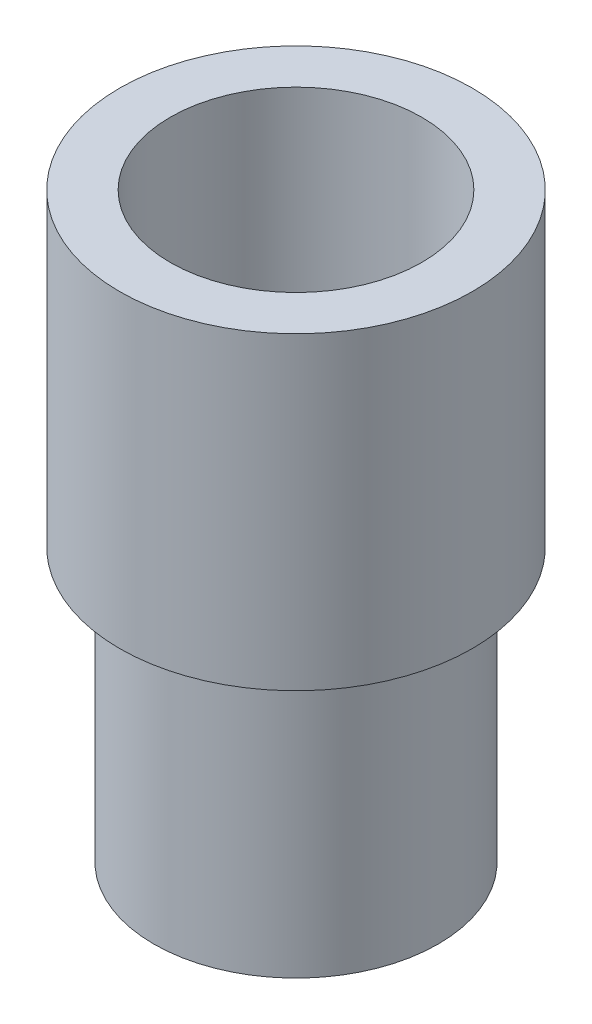
from build123d import *


with BuildPart() as part:
    # Sketch1 → Revolve1 (revolve)
    with BuildSketch(Plane.XY):
        Polygon((14.0462, 30.48), (14.0462, 0), (15.875, 0), (15.875, 30.48), (19.685, 30.48), (19.685, 65), (14.0462, 65), (14.0462, 40.48), (0, 40.48), (0, 30.48), align=None)
    revolve(axis=Axis((0, 0, 0), (0, 1, 0)))


solid = part.part
